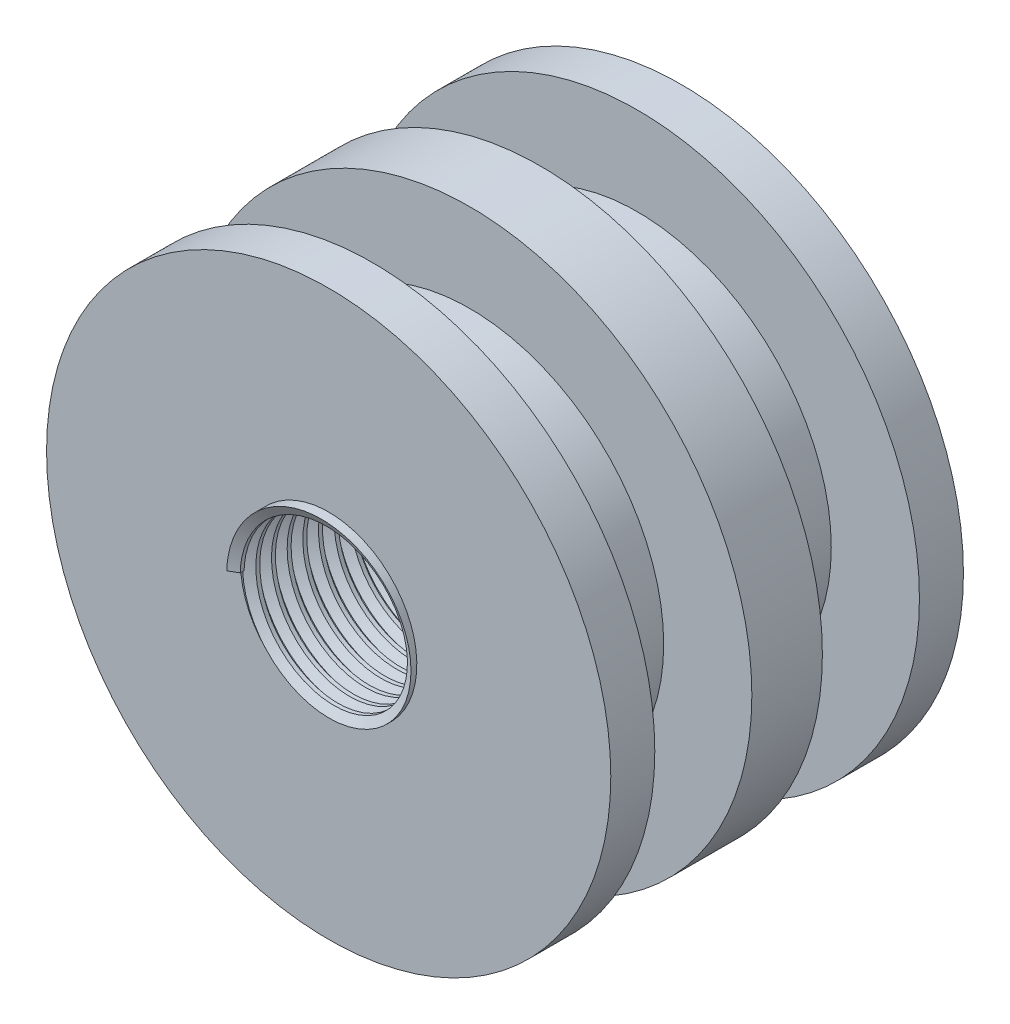
from build123d import *

# Parameters (mm, degrees)
F_97_0_625_DIAMETER_HOLE1_D = 15.875
THREAD1_PITCH               = 1.411111111


with BuildPart() as part:
    # Sketch1 → Revolve1 (revolve)
    with BuildSketch(Plane(origin=(0, 0, 0), x_dir=(0, 0, -1), z_dir=(1, 0, 0)), mode=Mode.PRIVATE) as revolve1_sk:
        Polygon((-15.875, 0), (15.875, 0), (15.875, 25.4), (11.9126, 25.4), (11.9126, 17.4625), (3.175, 17.4625), (3.175, 25.4), (-3.175, 25.4), (-3.175, 17.4625), (-11.9126, 17.4625), (-11.9126, 25.4), (-15.875, 25.4), align=None)
    revolve(revolve1_sk.sketch.rotate(Axis((0, 0, 9.984539474), (0, 0, -1)), 90), axis=Axis((0, 0, 9.984539474), (0, 0, -1)))

    # #97 (0.625) Diameter Hole1 (through all)
    with Locations(Plane.XY.offset(15.875)):
        with Locations((0, 0)):
            Hole(F_97_0_625_DIAMETER_HOLE1_D / 2)

    # Thread1: arcs per turn and ends read off the stored shape
    # Thread1: the profile of Thread Profile1 profile screwed along a right-hand helix through 22.5 turns, 8 arcs to a turn; built about Z, then put on its axis
    thread1_z = Axis((0, 0, 0), (0, 0, 1))
    thread1_corners = [(7.9378, 0, -0.000173205), (7.9378, 0, 1.234895423), (7.17371371, 0, 0.793749998), (7.17371371, 0, 0.44097222)]
    with BuildLine(mode=Mode.PRIVATE) as thread1_profile:
        Line(thread1_corners[0], thread1_corners[1])
        Line(thread1_corners[1], thread1_corners[2])
        Line(thread1_corners[2], thread1_corners[3])
        Line(thread1_corners[3], thread1_corners[0])
    thread1_cap = Face(thread1_profile.wire())
    thread1_turn_angles = [0, 22.5, 45, 67.5, 90, 112.5, 135, 157.5, 180, 202.5, 225, 247.5, 270, 292.5, 315, 337.5, 360]
    thread1_turn_weights = [1, 0.9238795325112867, 1, 0.9238795325112867, 1, 0.9238795325112867, 1, 0.9238795325112867, 1, 0.9238795325112867, 1, 0.9238795325112867, 1, 0.9238795325112867, 1, 0.9238795325112867, 1]
    thread1_turn_rails = [Edge.make_bspline([Vector(p[0], p[1], 0).rotate(thread1_z, thread1_turn_angles[k]) / thread1_turn_weights[k] + Vector(0, 0, p[2] + THREAD1_PITCH * thread1_turn_angles[k] / 360) for k in range(17)], [0, 0, 0, 1, 1, 2, 2, 3, 3, 4, 4, 5, 5, 6, 6, 7, 7, 8, 8, 8], 2, thread1_turn_weights) for p in thread1_corners]
    thread1_turn_sides = [Face.make_surface_from_curves(thread1_turn_rails[p[0]], thread1_turn_rails[p[1]]) for p in [(0, 1), (1, 2), (2, 3), (3, 0)]]
    thread1_last_angles = [7920, 7942.5, 7965, 7987.5, 8010, 8032.5, 8055, 8077.5, 8100]
    thread1_last_weights = [1, 0.9238795325112867, 1, 0.9238795325112867, 1, 0.9238795325112867, 1, 0.9238795325112837, 1]
    thread1_last_rails = [Edge.make_bspline([Vector(p[0], p[1], 0).rotate(thread1_z, thread1_last_angles[k]) / thread1_last_weights[k] + Vector(0, 0, p[2] + THREAD1_PITCH * thread1_last_angles[k] / 360) for k in range(9)], [0, 0, 0, 1, 1, 2, 2, 3, 3, 4, 4, 4], 2, thread1_last_weights) for p in thread1_corners]
    thread1_last_sides = [Face.make_surface_from_curves(thread1_last_rails[p[0]], thread1_last_rails[p[1]]) for p in [(0, 1), (1, 2), (2, 3), (3, 0)]]
    thread1 = Plane(origin=(0, 0, -15.875), x_dir=(1, 0, 0), z_dir=(0, 0, 1)) * Solid(Shell([*[p.moved(Location((0, 0, THREAD1_PITCH * i))) for i in range(22) for p in thread1_turn_sides], *thread1_last_sides, thread1_cap, thread1_cap.rotate(thread1_z, 8100).moved(Location((0, 0, THREAD1_PITCH * 8100 / 360)))]))
    add(thread1)


solid = part.part
